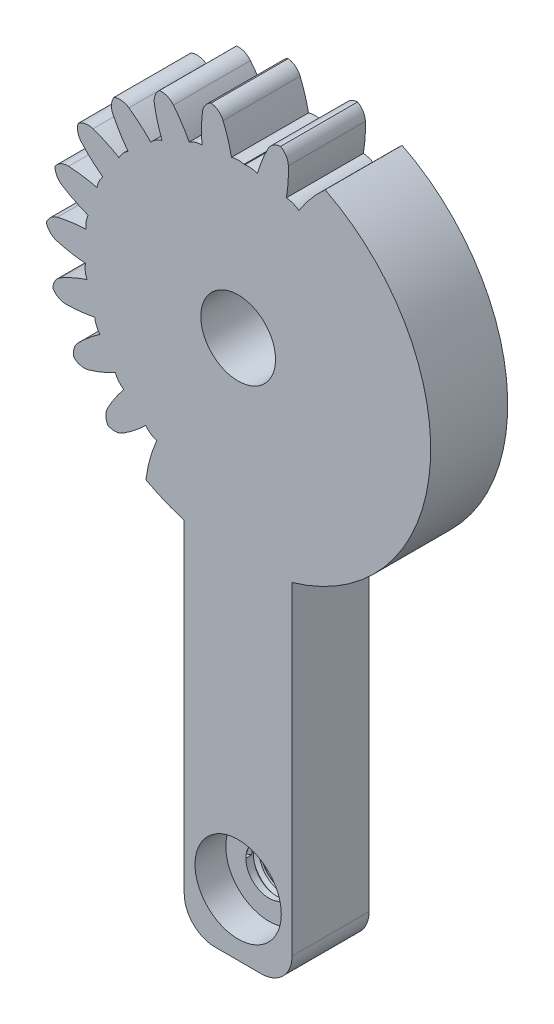
from build123d import *

# Parameters (mm, degrees)
BOSS_EXTRUDE2_DEPTH = 5
SKETCH3_R           = 2.425
CUT_EXTRUDE1_DEPTH  = 38.5
CUT_EXTRUDE2_DEPTH  = 38.5
CIRPATTERN1_COUNT   = 23
CIRPATTERN1_ANGLE   = 355.3
FILLET1_R           = 2
SKETCH14_R          = 2.8
CUT_EXTRUDE3_DEPTH  = 2
SKETCH15_R          = 1.5
CUT_EXTRUDE4_DEPTH  = 38.286056375
THREAD1_PITCH       = 0.5
FILLET8_R           = 1


with BuildPart() as part:
    # Sketch1 → Boss-Extrude2 (new body)
    with BuildSketch(Plane.XY):
        with BuildLine():
            Line((3.5, -35), (3.5, -12))
            ThreePointArc((3.5, -12), (0, 12.5), (-3.5, -12))
            Line((-3.5, -12), (-3.5, -35))
            Line((-3.5, -35), (3.5, -35))
        make_face()
    extrude(amount=BOSS_EXTRUDE2_DEPTH)

    # Sketch3 → Cut-Extrude1 (cut, through all)
    with BuildSketch(Plane.XY.offset(5)):
        Circle(SKETCH3_R)
    extrude(amount=-CUT_EXTRUDE1_DEPTH, mode=Mode.SUBTRACT)

    # Sketch6 → Cut-Extrude2 (cut, through all)
    with BuildSketch(Plane.XY.offset(5)):
        with BuildLine():
            ThreePointArc((1.306605791, 12.431523692), (0, 12.5), (-1.306605791, 12.431523692))
            ThreePointArc((-1.306605791, 12.431523692), (-0.782967595, 11.214222444), (-0.433810754, 9.935899798))
            ThreePointArc((-0.433810754, 9.935899798), (0, 10), (0.433810754, 9.935899798))
            ThreePointArc((0.433810754, 9.935899798), (0.782967595, 11.214222444), (1.306605791, 12.431523692))
        make_face()
    cut_extrude2 = extrude(amount=-CUT_EXTRUDE2_DEPTH, mode=Mode.SUBTRACT)

    # CirPattern1: Cut-Extrude2 ×23 about axis, 11 skipped
    cirpattern1_axis = Axis((0, 0, 0), (0, 0, 1))
    add([cut_extrude2.rotate(cirpattern1_axis, i * CIRPATTERN1_ANGLE / (CIRPATTERN1_COUNT - 1)) for i in range(1, CIRPATTERN1_COUNT) if i not in (10, 11, 12, 13, 14, 15, 16, 17, 18, 19, 20)], mode=Mode.SUBTRACT)

    # Fillet1
    fillet1_edges = [part.edges().sort_by_distance(p)[0] for p in [
        (3.5, -35, 2.5),
        (-3.5, -35, 2.5),
    ]]
    fillet(fillet1_edges, radius=FILLET1_R)

    # Sketch14 → Cut-Extrude3 (cut)
    with BuildSketch(Plane.XY.offset(5)):
        with Locations((0, -31)):
            Circle(SKETCH14_R)
    extrude(amount=-CUT_EXTRUDE3_DEPTH, mode=Mode.SUBTRACT)

    # Sketch15 → Cut-Extrude4 (cut, through all)
    with BuildSketch(Plane.XY.offset(3)):
        with Locations((0, -31)):
            Circle(SKETCH15_R)
    extrude(amount=-CUT_EXTRUDE4_DEPTH, mode=Mode.SUBTRACT)

    # Thread1: the profile of Thread Profile2 profile screwed along a right-hand helix of 20 turns, 6 arcs to a turn; built about Z, then put on its axis
    thread1_z = Axis((0, 0, 0), (0, 0, 1))
    thread1_corners = [(1.4997, 0, -0.000173205), (1.770632938, 0, 0.156249999), (1.770632938, 0, 0.218749999), (1.4997, 0, 0.375173204)]
    with BuildLine(mode=Mode.PRIVATE) as thread1_profile:
        Line(thread1_corners[0], thread1_corners[1])
        Line(thread1_corners[1], thread1_corners[2])
        Line(thread1_corners[2], thread1_corners[3])
        Line(thread1_corners[3], thread1_corners[0])
    thread1_cap = Face(thread1_profile.wire())
    thread1_turn_angles = [0, 30, 60, 90, 120, 150, 180, 210, 240, 270, 300, 330, 360]
    thread1_turn_weights = [1, 0.8660254037844387, 1, 0.8660254037844387, 1, 0.8660254037844387, 1, 0.8660254037844387, 1, 0.8660254037844387, 1, 0.8660254037844387, 1]
    thread1_turn_rails = [Edge.make_bspline([Vector(p[0], p[1], 0).rotate(thread1_z, thread1_turn_angles[k]) / thread1_turn_weights[k] + Vector(0, 0, p[2] + THREAD1_PITCH * thread1_turn_angles[k] / 360) for k in range(13)], [0, 0, 0, 1, 1, 2, 2, 3, 3, 4, 4, 5, 5, 6, 6, 6], 2, thread1_turn_weights) for p in thread1_corners]
    thread1_turn_sides = [Face.make_surface_from_curves(thread1_turn_rails[p[0]], thread1_turn_rails[p[1]]) for p in [(0, 1), (1, 2), (2, 3), (3, 0)]]
    thread1 = Plane(origin=(0, -31, 3), x_dir=(-1, 0, 0), z_dir=(0, 0, -1)) * Solid(Shell([*[p.moved(Location((0, 0, THREAD1_PITCH * i))) for i in range(20) for p in thread1_turn_sides], thread1_cap, thread1_cap.rotate(thread1_z, 7200).moved(Location((0, 0, THREAD1_PITCH * 7200 / 360)))]))
    add(thread1, mode=Mode.SUBTRACT)

    # Fillet8
    # the kernel refuses this fillet: 1 mm, written as the material it takes off along each edge
    with BuildSketch(Plane(origin=(-8.142956982, -9.483788883, 6.946106865), x_dir=(0.8623088222423695, 0.5063827555150131, 0), z_dir=(0, 0, -1)), Plane(origin=(-10.459553918, -6.844540294, 6.946106865), x_dir=(0.9691312196596906, 0.24654549089553573, 0), z_dir=(0, 0, -1)), Plane(origin=(-11.950615618, -3.665076583, 6.946106865), x_dir=(0.9994635509919061, -0.03275072882623207, 0), z_dir=(0, 0, -1)), Plane(origin=(-12.498457906, -0.196341466, 6.946106865), x_dir=(0.9509117936535796, -0.3094620504852445, 0), z_dir=(0, 0, -1)), Plane(origin=(-12.059841548, 3.287890181, 6.946106865), x_dir=(0.8273079644573174, -0.5617486376890379, 0), z_dir=(0, 0, -1))) as fillet8_piece_1:
        with BuildLine():
            CenterArc((0.737472075, -0.99916035), FILLET8_R, 87.651896245, 76.940630342)
            ThreePointArc((-0.226588683, -0.733478482), (-0.11892644, -0.364999354), (0, 0))
            ThreePointArc((0, 0), (0.389221373, 0.007976679), (0.778442746, 0))
        make_face()
    extrude(amount=8.892213729, mode=Mode.SUBTRACT)
    with BuildSketch(Plane(origin=(-8.807927625, -8.869634207, 6.946106865), x_dir=(0.7308734721957416, -0.6825129798330144, 0), z_dir=(0, 0, -1)), Plane(origin=(-10.927453724, -6.069658565, 6.946106865), x_dir=(0.5121878326688029, -0.8588734621968677, 0), z_dir=(0, 0, -1)), Plane(origin=(-12.184514927, -2.79062645, 6.946106865), x_dir=(0.25307703669856935, -0.9674461295058608, 0), z_dir=(0, 0, -1)), Plane(origin=(-12.479895882, 0.708659845, 6.946106865), x_dir=(-0.02600822595791031, -0.9996617288775851, 0), z_dir=(0, 0, -1)), Plane(origin=(-11.790283224, 4.152014149, 6.946106865), x_dir=(-0.3030407522233638, -0.9529775981060088, 0), z_dir=(0, 0, -1))) as fillet8_piece_2:
        with BuildLine():
            CenterArc((0.736973133, -0.999528422), FILLET8_R, 88.240329629, 76.940630342)
            ThreePointArc((-0.229765315, -0.743761392), (-0.122503958, -0.369526298), (0, 0))
            ThreePointArc((0, 0), (0.383840173, 0.005894721), (0.767680347, 0))
        make_face()
    extrude(amount=8.892213729, mode=Mode.SUBTRACT)
    with BuildSketch(Plane(origin=(-10.669384966, 6.512620398, 6.946106865), x_dir=(0.5469741022040291, 0.8371495275744331, 0), z_dir=(0, 0, -1)), Plane(origin=(-8.436831933, 9.223332746, 6.946106865), x_dir=(0.7582443864464455, 0.6519704367702982, 0), z_dir=(0, 0, -1)), Plane(origin=(-5.538389885, 11.20608038, 6.946106865), x_dir=(0.9096691492038387, 0.4153336477902607, 0), z_dir=(0, 0, -1)), Plane(origin=(-2.202822504, 12.30437211, 6.946106865), x_dir=(0.9892969747388247, 0.14591605728160742, 0), z_dir=(0, 0, -1)), Plane(origin=(2.320832692, 12.282659957, 6.946106865), x_dir=(0.9764481138094177, -0.21575236044602294, 0), z_dir=(0, 0, -1))) as fillet8_piece_3:
        with BuildLine():
            CenterArc((0.736973133, 0.999528422), FILLET8_R, 194.819040029, 76.940630342)
            ThreePointArc((-0.229765315, 0.743761392), (-0.122503958, 0.369526298), (0, 0))
            ThreePointArc((0, 0), (0.383840173, -0.005894721), (0.767680347, 0))
        make_face()
    extrude(amount=8.892213729, mode=Mode.SUBTRACT)
    with BuildSketch(Plane(origin=(-10.170105619, 7.267664804, 6.946106865), x_dir=(0.9582068866792373, -0.28607614776573664, 0), z_dir=(0, 0, -1)), Plane(origin=(-7.747237897, 9.809704632, 6.946106865), x_dir=(0.8408200283252899, -0.5413147697662227, 0), z_dir=(0, 0, -1)), Plane(origin=(-4.712908357, 11.577499506, 6.946106865), x_dir=(0.6570702479772857, -0.7538293502000756, 0), z_dir=(0, 0, -1)), Plane(origin=(-1.306605791, 12.431523692, 6.946106865), x_dir=(0.4214602595678894, -0.9068468721923053, 0), z_dir=(0, 0, -1)), Plane(origin=(3.203617164, 12.082501275, 6.946106865), x_dir=(0.07109380478689951, -0.9974696340846283, 0), z_dir=(0, 0, -1))) as fillet8_piece_4:
        with BuildLine():
            CenterArc((0.737472075, 0.99916035), FILLET8_R, 195.407473413, 76.940630342)
            ThreePointArc((-0.226588683, 0.733478482), (-0.11892644, 0.364999354), (0, 0))
            ThreePointArc((0, 0), (0.389221373, -0.007976679), (0.778442746, 0))
        make_face()
    extrude(amount=8.892213729, mode=Mode.SUBTRACT)


solid = part.part
